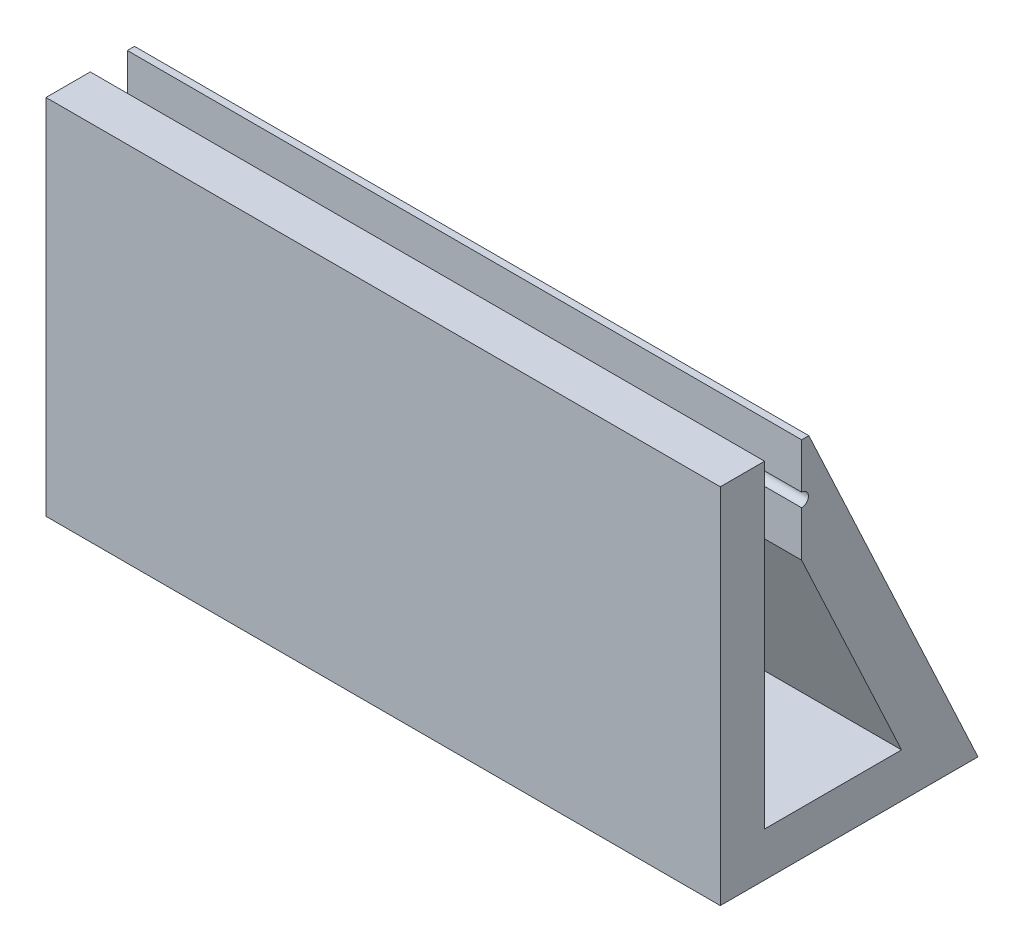
from build123d import *

# Parameters (mm, degrees)
BOSS_EXTRUDE1_DEPTH = 10


with BuildPart() as part:
    # Sketch1 → Boss-Extrude1 (new, symmetric)
    with BuildSketch(Plane(origin=(0, 0, 0), x_dir=(0, 0, -1), z_dir=(1, 0, 0))):
        with BuildLine():
            Line((0, 0), (7.642988179, 0))
            Line((7.642988179, 0), (2.625742665, 10.759517727))
            Line((2.625742665, 10.759517727), (2.412842466, 10.759517727))
            Line((2.412842466, 10.759517727), (2.412842466, 9.413149515))
            ThreePointArc((2.412842466, 9.413149515), (2.612842466, 9.213149515), (2.412842466, 9.013149515))
            Line((2.412842466, 9.013149515), (2.412842466, 7.666781302))
            Line((2.412842466, 7.666781302), (5.375732805, 1.312842466))
            Line((5.375732805, 1.312842466), (1.312842466, 1.312842466))
            Line((1.312842466, 1.312842466), (1.312842466, 10.759517727))
            Line((1.312842466, 10.759517727), (0, 10.759517727))
            Line((0, 10.759517727), (0, 0))
        make_face()
    extrude(amount=BOSS_EXTRUDE1_DEPTH, both=True)


solid = part.part
